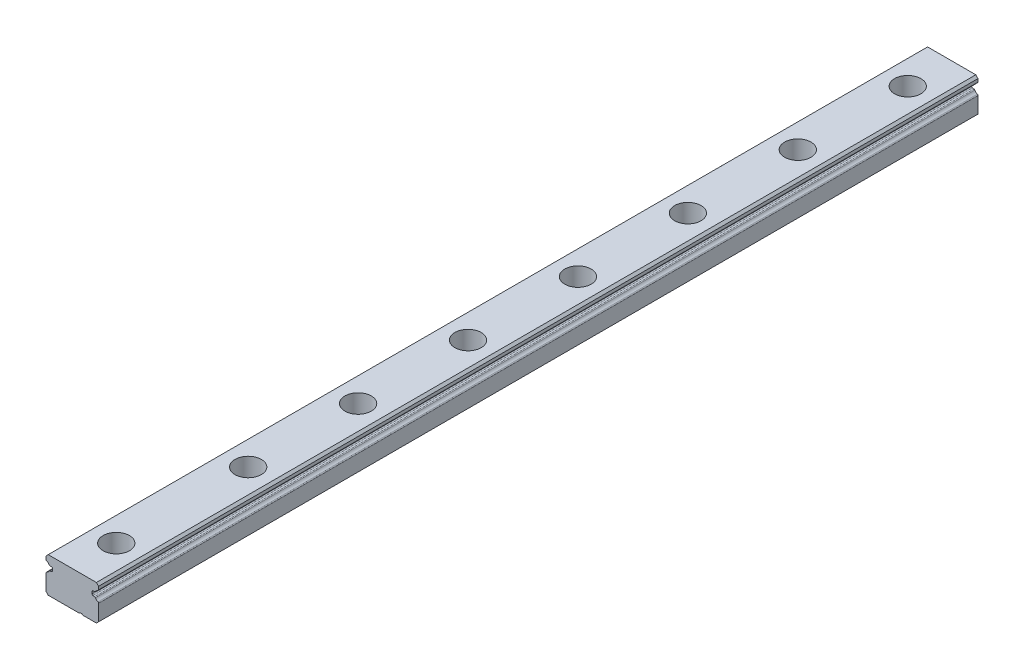
from build123d import *

# Parameters (mm, degrees)
RAIL_PROFILE_DEPTH             = 100
CBORE_FOR_M3_SHCS1_D           = 3.5
CBORE_FOR_M3_SHCS1_CBORE_D     = 6
CBORE_FOR_M3_SHCS1_CBORE_DEPTH = 4.5
FILL_START                     = -2.000000001
FILL_PATTERN1_OUTLINE_R        = 3
FILL_PATTERN1_DEPTH            = 4.5
FILL_START_2                   = -5.5
FILL_PATTERN1_2_OUTLINE_R      = 1.75
FILL_PATTERN1_2_DEPTH          = 3.499999999


# Read off the part's stored shape, not the designer's step: Fill Pattern1
with BuildPart() as part:
    # Sketch1 → RAIL PROFILE (new, symmetric)
    with BuildSketch(Plane.XY):
        with BuildLine():
            Line((-5.982334879, -1.370069213), (-5.982334879, -5.001472146))
            Line((-5.982334879, -5.001472146), (-5.483807025, -5.499999999))
            Line((-5.483807025, -5.499999999), (1.595289228, -5.499999999))
            ThreePointArc((1.595289228, -5.499999999), (1.994111552, -5.300588838), (2.392933875, -5.5))
            Line((2.392933875, -5.5), (5.483807024, -5.5))
            Line((5.483807024, -5.5), (5.982334878, -5.001472147))
            Line((5.982334878, -5.001472147), (5.982334878, -1.370069213))
            ThreePointArc((5.982334878, -1.370069213), (5.940056641, -1.231182813), (5.82756375, -1.139410101))
            ThreePointArc((5.82756375, -1.139410101), (5.497041405, -0.930122348), (5.251697363, -0.625405104))
            ThreePointArc((5.251697363, -0.625405104), (5.169975597, -0.541388466), (5.058890009, -0.504008866))
            Line((5.058890009, -0.504008866), (4.71429032, -0.473860299))
            ThreePointArc((4.71429032, -0.473860299), (4.552238438, -0.393945155), (4.486751147, -0.225544865))
            Line((4.486751147, -0.225544865), (4.486751147, 0.225544865))
            ThreePointArc((4.486751147, 0.225544865), (4.552238438, 0.393945155), (4.71429032, 0.473860299))
            Line((4.71429032, 0.473860299), (5.079776582, 0.505836204))
            ThreePointArc((5.079776582, 0.505836204), (5.187925163, 0.5413949), (5.268982803, 0.621333598))
            ThreePointArc((5.268982803, 0.621333598), (5.511607978, 0.899707672), (5.82756375, 1.09083865))
            ThreePointArc((5.82756375, 1.09083865), (5.940040963, 1.182638806), (5.982312115, 1.321532803))
            Line((5.982312115, 1.321532803), (5.982321902, 2.00145917))
            Line((5.982321902, 2.00145917), (5.483807025, 2.499999999))
            Line((5.483807025, 2.499999999), (-5.483807026, 2.499999999))
            Line((-5.483807026, 2.499999999), (-5.982321903, 2.00145917))
            Line((-5.982321903, 2.00145917), (-5.982321903, 1.32884687))
            ThreePointArc((-5.982321903, 1.32884687), (-5.942177076, 1.185718341), (-5.827697321, 1.090893402))
            ThreePointArc((-5.827697321, 1.090893402), (-5.511663234, 0.899754111), (-5.268982805, 0.621333597))
            ThreePointArc((-5.268982805, 0.621333597), (-5.187925164, 0.541394898), (-5.079776582, 0.505836204))
            Line((-5.079776582, 0.505836204), (-4.71429032, 0.473860299))
            ThreePointArc((-4.71429032, 0.473860299), (-4.552238438, 0.393945155), (-4.486751147, 0.225544865))
            Line((-4.486751147, 0.225544865), (-4.486751147, -0.225544865))
            ThreePointArc((-4.486751147, -0.225544865), (-4.552238438, -0.393945155), (-4.71429032, -0.473860299))
            Line((-4.71429032, -0.473860299), (-5.058890009, -0.504008866))
            ThreePointArc((-5.058890009, -0.504008866), (-5.169975597, -0.541388466), (-5.251697363, -0.625405104))
            ThreePointArc((-5.251697363, -0.625405104), (-5.499180752, -0.921502608), (-5.828043428, -1.123421157))
            ThreePointArc((-5.828043428, -1.123421157), (-5.944906256, -1.221900029), (-5.982334879, -1.370069213))
        make_face()
    extrude(amount=RAIL_PROFILE_DEPTH, both=True)

    # CBORE for M3 SHCS1 (through all)
    with Locations(Plane(origin=(0, 2.499999999, 0), x_dir=(1, 0, 0), z_dir=(0, 1, 0))):
        with Locations((0, 90)):
            cbore_for_m3_shcs1 = CounterBoreHole(CBORE_FOR_M3_SHCS1_D / 2, CBORE_FOR_M3_SHCS1_CBORE_D / 2, CBORE_FOR_M3_SHCS1_CBORE_DEPTH)

    # M3 END MIRROR: CBORE for M3 SHCS1 across plane
    add(cbore_for_m3_shcs1.mirror(Plane.XY), mode=Mode.SUBTRACT)

    # Fill Pattern1 outline → Fill Pattern1 (cut)
    with BuildSketch(Plane(origin=(0, 0, 0), x_dir=(1, 0, 0), z_dir=(0, 1, 0)).offset(FILL_START)):
        with Locations((0, 65)):
            Circle(FILL_PATTERN1_OUTLINE_R)
        with Locations((0, 40)):
            Circle(FILL_PATTERN1_OUTLINE_R)
        with Locations((0, 15)):
            Circle(FILL_PATTERN1_OUTLINE_R)
        with Locations((0, -10)):
            Circle(FILL_PATTERN1_OUTLINE_R)
        with Locations((0, -35)):
            Circle(FILL_PATTERN1_OUTLINE_R)
        with Locations((0, -60)):
            Circle(FILL_PATTERN1_OUTLINE_R)
    extrude(amount=FILL_PATTERN1_DEPTH, mode=Mode.SUBTRACT)

    # Fill Pattern1 2 outline → Fill Pattern1 2 (cut)
    with BuildSketch(Plane(origin=(0, 0, 0), x_dir=(1, 0, 0), z_dir=(0, 1, 0)).offset(FILL_START_2)):
        with Locations((0, 65)):
            Circle(FILL_PATTERN1_2_OUTLINE_R)
        with Locations((0, 40)):
            Circle(FILL_PATTERN1_2_OUTLINE_R)
        with Locations((0, 15)):
            Circle(FILL_PATTERN1_2_OUTLINE_R)
        with Locations((0, -10)):
            Circle(FILL_PATTERN1_2_OUTLINE_R)
        with Locations((0, -35)):
            Circle(FILL_PATTERN1_2_OUTLINE_R)
        with Locations((0, -60)):
            Circle(FILL_PATTERN1_2_OUTLINE_R)
    extrude(amount=FILL_PATTERN1_2_DEPTH, mode=Mode.SUBTRACT)


solid = part.part
